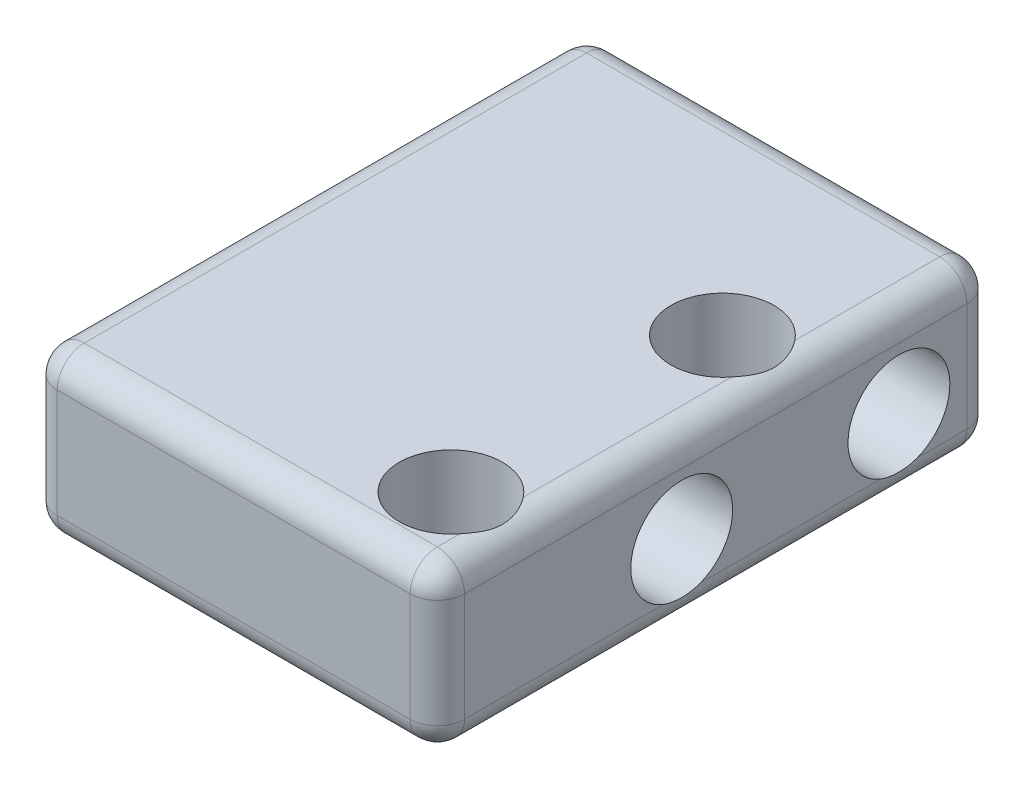
from build123d import *

# Parameters (mm, degrees)
SKETCH1_W           = 30
SKETCH1_H           = 41
SKETCH1_R           = 2.25
BOSS_EXTRUDE1_DEPTH = 12
SKETCH3_R           = 3.8
CUT_EXTRUDE2_DEPTH  = 7
FILLET1_R           = 2
SKETCH4_R           = 2.25
CUT_EXTRUDE3_DEPTH  = 53.201532625
CUT_EXTRUDE4_START  = -30
SKETCH5_R           = 3.75
CUT_EXTRUDE4_DEPTH  = 6


with BuildPart() as part:
    # Sketch1 → Boss-Extrude1 (new body)
    with BuildSketch(Plane(origin=(0, 0, 0), x_dir=(1, 0, 0), z_dir=(0, 1, 0))):
        with Locations((-15, 20.5)):
            Rectangle(SKETCH1_W, SKETCH1_H)
        with Locations(Location((-5, 6, 0), (0, 0, 270))):
            Circle(SKETCH1_R, mode=Mode.SUBTRACT)
        with Locations(Location((-5, 26, 0), (0, 0, 270))):
            Circle(SKETCH1_R, mode=Mode.SUBTRACT)
    extrude(amount=BOSS_EXTRUDE1_DEPTH)

    # Sketch3 → Cut-Extrude2 (cut)
    with BuildSketch(Plane(origin=(0, 12, 0), x_dir=(1, 0, 0), z_dir=(0, 1, 0))):
        with Locations(Location((-5, 26, 0), (0, 0, 270))):
            Circle(SKETCH3_R)
        with Locations(Location((-5, 6, 0), (0, 0, 270))):
            Circle(SKETCH3_R)
    extrude(amount=-CUT_EXTRUDE2_DEPTH, mode=Mode.SUBTRACT)

    # Fillet1
    # the kernel refuses this fillet: 2 mm, written as the material it takes off along each edge
    with BuildSketch(Plane(origin=(-28, 10, -2), x_dir=(-1, 0, 0), z_dir=(0, 0, 1))) as fillet1_piece_1_section:
        Polygon((0, 0), (FILLET1_R, 0), (FILLET1_R, -FILLET1_R), (0, -FILLET1_R), align=None)
    fillet1_piece_1 = extrude(amount=FILLET1_R, mode=Mode.PRIVATE)
    fillet1_piece_1 = fillet1_piece_1 - Plane(origin=(-28, 10, -2), x_dir=(0.7071067811865475, -0.7071067811865475, 0), z_dir=(0, 0, 1)) * Sphere(FILLET1_R, mode=Mode.PRIVATE)
    add(fillet1_piece_1, mode=Mode.SUBTRACT)
    with BuildSketch(Plane(origin=(-28, 10, -39), x_dir=(0, 1, 0), z_dir=(-1, 0, 0))) as fillet1_piece_2_section:
        Polygon((0, 0), (FILLET1_R, 0), (FILLET1_R, FILLET1_R), (0, FILLET1_R), align=None)
    fillet1_piece_2 = extrude(amount=FILLET1_R, mode=Mode.PRIVATE)
    fillet1_piece_2 = fillet1_piece_2 - Plane(origin=(-28, 10, -39), x_dir=(0, -0.7071067811865475, 0.7071067811865475), z_dir=(-1, 0, 0)) * Sphere(FILLET1_R, mode=Mode.PRIVATE)
    add(fillet1_piece_2, mode=Mode.SUBTRACT)
    with BuildSketch(Plane(origin=(-2, 10, -2), x_dir=(1, 0, 0), z_dir=(0, 0, 1))) as fillet1_piece_3_section:
        Polygon((0, 0), (FILLET1_R, 0), (FILLET1_R, FILLET1_R), (0, FILLET1_R), align=None)
    fillet1_piece_3 = extrude(amount=FILLET1_R, mode=Mode.PRIVATE)
    fillet1_piece_3 = fillet1_piece_3 - Plane(origin=(-2, 10, -2), x_dir=(-0.7071067811865475, -0.7071067811865475, 0), z_dir=(0, 0, 1)) * Sphere(FILLET1_R, mode=Mode.PRIVATE)
    add(fillet1_piece_3, mode=Mode.SUBTRACT)
    with BuildSketch(Plane(origin=(-2, 10, -39), x_dir=(0, 1, 0), z_dir=(1, 0, 0))) as fillet1_piece_4_section:
        Polygon((0, 0), (FILLET1_R, 0), (FILLET1_R, -FILLET1_R), (0, -FILLET1_R), align=None)
    fillet1_piece_4 = extrude(amount=FILLET1_R, mode=Mode.PRIVATE)
    fillet1_piece_4 = fillet1_piece_4 - Plane(origin=(-2, 10, -39), x_dir=(0, -0.7071067811865475, 0.7071067811865475), z_dir=(1, 0, 0)) * Sphere(FILLET1_R, mode=Mode.PRIVATE)
    add(fillet1_piece_4, mode=Mode.SUBTRACT)
    with BuildSketch(Plane(origin=(-2, 2, -2), x_dir=(1, 0, 0), z_dir=(0, 0, 1))) as fillet1_piece_5_section:
        Polygon((0, 0), (FILLET1_R, 0), (FILLET1_R, -FILLET1_R), (0, -FILLET1_R), align=None)
    fillet1_piece_5 = extrude(amount=FILLET1_R, mode=Mode.PRIVATE)
    fillet1_piece_5 = fillet1_piece_5 - Plane(origin=(-2, 2, -2), x_dir=(-0.7071067811865475, 0.7071067811865475, 0), z_dir=(0, 0, 1)) * Sphere(FILLET1_R, mode=Mode.PRIVATE)
    add(fillet1_piece_5, mode=Mode.SUBTRACT)
    with BuildSketch(Plane(origin=(-28, 2, -2), x_dir=(-1, 0, 0), z_dir=(0, 0, 1))) as fillet1_piece_6_section:
        Polygon((0, 0), (FILLET1_R, 0), (FILLET1_R, FILLET1_R), (0, FILLET1_R), align=None)
    fillet1_piece_6 = extrude(amount=FILLET1_R, mode=Mode.PRIVATE)
    fillet1_piece_6 = fillet1_piece_6 - Plane(origin=(-28, 2, -2), x_dir=(0.7071067811865475, 0.7071067811865475, 0), z_dir=(0, 0, 1)) * Sphere(FILLET1_R, mode=Mode.PRIVATE)
    add(fillet1_piece_6, mode=Mode.SUBTRACT)
    with BuildSketch(Plane(origin=(-28, 2, -39), x_dir=(0, -1, 0), z_dir=(-1, 0, 0))) as fillet1_piece_7_section:
        Polygon((0, 0), (FILLET1_R, 0), (FILLET1_R, -FILLET1_R), (0, -FILLET1_R), align=None)
    fillet1_piece_7 = extrude(amount=FILLET1_R, mode=Mode.PRIVATE)
    fillet1_piece_7 = fillet1_piece_7 - Plane(origin=(-28, 2, -39), x_dir=(0, 0.7071067811865475, 0.7071067811865475), z_dir=(-1, 0, 0)) * Sphere(FILLET1_R, mode=Mode.PRIVATE)
    add(fillet1_piece_7, mode=Mode.SUBTRACT)
    with BuildSketch(Plane(origin=(-2, 2, -39), x_dir=(0, -1, 0), z_dir=(1, 0, 0))) as fillet1_piece_8_section:
        Polygon((0, 0), (FILLET1_R, 0), (FILLET1_R, FILLET1_R), (0, FILLET1_R), align=None)
    fillet1_piece_8 = extrude(amount=FILLET1_R, mode=Mode.PRIVATE)
    fillet1_piece_8 = fillet1_piece_8 - Plane(origin=(-2, 2, -39), x_dir=(0, 0.7071067811865475, 0.7071067811865475), z_dir=(1, 0, 0)) * Sphere(FILLET1_R, mode=Mode.PRIVATE)
    add(fillet1_piece_8, mode=Mode.SUBTRACT)
    with BuildSketch(Plane(origin=(-30, 12, -2), x_dir=(0, -1, 0), z_dir=(0, 0, -1)), Plane(origin=(0, 12, -39), x_dir=(0, -1, 0), z_dir=(0, 0, 1))) as fillet1_piece_9:
        with BuildLine():
            CenterArc((FILLET1_R, -FILLET1_R), FILLET1_R, 90, 90)
            Line((0, -FILLET1_R), (0, 0))
            Line((0, 0), (FILLET1_R, 0))
        make_face()
    extrude(amount=37, mode=Mode.SUBTRACT)
    with BuildSketch(Plane(origin=(-2, 12, 0), x_dir=(0, -1, 0), z_dir=(-1, 0, 0)), Plane(origin=(-28, 0, -41), x_dir=(0, 0, 1), z_dir=(1, 0, 0))) as fillet1_piece_10:
        with BuildLine():
            CenterArc((FILLET1_R, -FILLET1_R), FILLET1_R, 90, 90)
            Line((0, -FILLET1_R), (0, 0))
            Line((0, 0), (FILLET1_R, 0))
        make_face()
    extrude(amount=26, mode=Mode.SUBTRACT)
    with BuildSketch(Plane(origin=(-2, 0, 0), x_dir=(0, 1, 0), z_dir=(-1, 0, 0)), Plane(origin=(-28, 12, -41), x_dir=(0, 0, 1), z_dir=(1, 0, 0))) as fillet1_piece_11:
        with BuildLine():
            CenterArc((FILLET1_R, FILLET1_R), FILLET1_R, 180, 90)
            Line((0, FILLET1_R), (0, 0))
            Line((0, 0), (FILLET1_R, 0))
        make_face()
    extrude(amount=26, mode=Mode.SUBTRACT)
    with BuildSketch(Plane(origin=(-30, 0, -2), x_dir=(0, 1, 0), z_dir=(0, 0, -1)), Plane(origin=(0, 0, -39), x_dir=(0, 1, 0), z_dir=(0, 0, 1))) as fillet1_piece_12:
        with BuildLine():
            CenterArc((FILLET1_R, FILLET1_R), FILLET1_R, 180, 90)
            Line((0, FILLET1_R), (0, 0))
            Line((0, 0), (FILLET1_R, 0))
        make_face()
    extrude(amount=37, mode=Mode.SUBTRACT)
    with BuildSketch(Plane(origin=(0, 2, 0), x_dir=(-1, 0, 0), z_dir=(0, 1, 0)), Plane(origin=(0, 2, -41), x_dir=(0, 0, 1), z_dir=(0, 1, 0))) as fillet1_piece_13:
        with BuildLine():
            CenterArc((FILLET1_R, -FILLET1_R), FILLET1_R, 90, 90)
            Line((0, -FILLET1_R), (0, 0))
            Line((0, 0), (FILLET1_R, 0))
        make_face()
    extrude(amount=8, mode=Mode.SUBTRACT)
    with BuildSketch(Plane(origin=(-30, 2, 0), x_dir=(1, 0, 0), z_dir=(0, 1, 0)), Plane(origin=(-30, 2, -41), x_dir=(0, 0, 1), z_dir=(0, 1, 0))) as fillet1_piece_14:
        with BuildLine():
            CenterArc((FILLET1_R, FILLET1_R), FILLET1_R, 180, 90)
            Line((0, FILLET1_R), (0, 0))
            Line((0, 0), (FILLET1_R, 0))
        make_face()
    extrude(amount=8, mode=Mode.SUBTRACT)

    # Sketch4 → Cut-Extrude3 (cut, through all)
    with BuildSketch(Plane.ZY.offset(30)):
        with Locations((-34, 5.5)):
            Circle(SKETCH4_R)
        with Locations((-18, 5.5)):
            Circle(SKETCH4_R)
    extrude(amount=-CUT_EXTRUDE3_DEPTH, mode=Mode.SUBTRACT)

    # Sketch5 → Cut-Extrude4 (cut)
    with BuildSketch(Plane.ZY.offset(30).offset(CUT_EXTRUDE4_START)):
        with Locations(Location((-34, 5.5, 0), (0, 0, 248.960530219))):
            Circle(SKETCH5_R)
        with Locations(Location((-18, 5.5, 0), (0, 0, 248.960530219))):
            Circle(SKETCH5_R)
    extrude(amount=CUT_EXTRUDE4_DEPTH, mode=Mode.SUBTRACT)


solid = part.part
